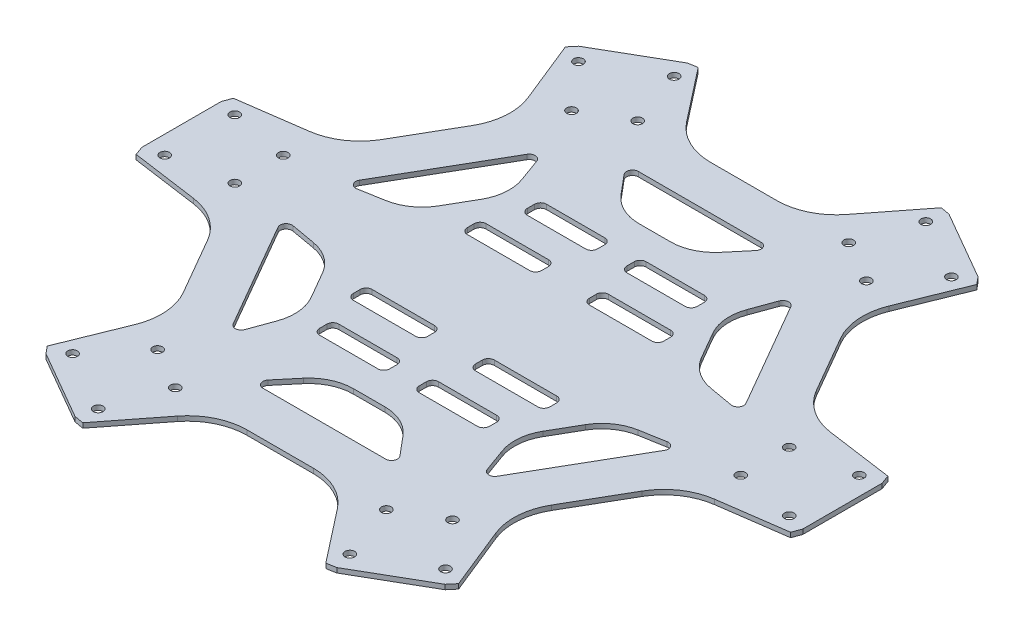
from build123d import *

# Parameters (mm, degrees)
SKETCH1_R            = 1.625
BOSS_EXTRUDE1_DEPTH  = 1.6
CIRPATTERN2_COUNT    = 6
CUT_EXTRUDE1_DEPTH   = 152.890574984
MIRROR6_COPY_1_DEPTH = 152.890574984
MIRROR6_COPY_2_DEPTH = 152.890574984


with BuildPart() as part:
    # Sketch1 → Boss-Extrude1 (new body)
    with BuildSketch(Plane(origin=(0, 0, 0), x_dir=(1, 0, 0), z_dir=(0, 1, 0))):
        with BuildLine():
            Line((0, 0), (-41.603860398, 24.02))
            Line((-41.603860398, 24.02), (-44.228357667, 19.474237386))
            ThreePointArc((-44.228357667, 19.474237386), (-48.615092178, 14.686956722), (-54.614016059, 12.202121091))
            Line((-54.614016059, 12.202121091), (-62.913996832, 10.738610541))
            ThreePointArc((-62.913996832, 10.738610541), (-64.899597276, 11.561073174), (-64.993343995, 13.708226047))
            Line((-64.993343995, 13.708226047), (-54.680843995, 31.57))
            Line((-54.680843995, 31.57), (-67.498019971, 38.97))
            Line((-67.498019971, 38.97), (-73.074504849, 29.311244864))
            ThreePointArc((-73.074504849, 29.311244864), (-79.211154855, 22.730493412), (-87.611550905, 19.505883489))
            Line((-87.611550905, 19.505883489), (-110.066828729, 16.35))
            Line((-110.066828729, 16.35), (-111.161293187, 13.342983613))
            Line((-111.161293187, 13.342983613), (-111.161293187, 0))
            Line((-111.161293187, 0), (-111.161293187, -13.342983613))
            Line((-111.161293187, -13.342983613), (-110.066828729, -16.35))
            Line((-110.066828729, -16.35), (-87.611550905, -19.505883489))
            ThreePointArc((-87.611550905, -19.505883489), (-79.211154855, -22.730493412), (-73.074504849, -29.311244864))
            Line((-73.074504849, -29.311244864), (-67.498019971, -38.97))
            Line((-67.498019971, -38.97), (-54.680843995, -31.57))
            Line((-54.680843995, -31.57), (-64.993343995, -13.708226047))
            ThreePointArc((-64.993343995, -13.708226047), (-64.899597276, -11.561073174), (-62.913996832, -10.738610541))
            Line((-62.913996832, -10.738610541), (-54.614016059, -12.202121091))
            ThreePointArc((-54.614016059, -12.202121091), (-48.615092178, -14.686956722), (-44.228357667, -19.474237386))
            Line((-44.228357667, -19.474237386), (-41.603860398, -24.02))
            Line((-41.603860398, -24.02), (0, 0))
        make_face()
        with Locations((-105.036293187, 11.780646598)):
            Circle(SKETCH1_R, mode=Mode.SUBTRACT)
        with Locations((-85.076293187, 8.143141746)):
            Circle(SKETCH1_R, mode=Mode.SUBTRACT)
        with Locations((-105.036293187, -11.780646598)):
            Circle(SKETCH1_R, mode=Mode.SUBTRACT)
        with Locations((-85.076293187, -8.143141746)):
            Circle(SKETCH1_R, mode=Mode.SUBTRACT)
    boss_extrude1 = extrude(amount=BOSS_EXTRUDE1_DEPTH)

    # CirPattern2: Boss-Extrude1 ×6 about axis
    cirpattern2_axis = Axis((0, 1.6, 0), (0, -1, 0))
    for i in range(1, CIRPATTERN2_COUNT):
        add(boss_extrude1.rotate(cirpattern2_axis, i * 360 / CIRPATTERN2_COUNT))

    # Sketch2 → Cut-Extrude1 (cut, through all)
    with BuildSketch(Plane(origin=(0, 0, 0), x_dir=(1, 0, 0), z_dir=(0, 1, 0))):
        with BuildLine():
            Line((-26.56, 38.16), (-6.96, 38.16))
            ThreePointArc((-6.96, 38.16), (-5.545786438, 37.574213562), (-4.96, 36.16))
            Line((-4.96, 36.16), (-4.96, 33.7))
            ThreePointArc((-4.96, 33.7), (-5.545786438, 32.285786438), (-6.96, 31.7))
            Line((-6.96, 31.7), (-26.56, 31.7))
            ThreePointArc((-26.56, 31.7), (-27.974213562, 32.285786438), (-28.56, 33.7))
            Line((-28.56, 33.7), (-28.56, 36.16))
            ThreePointArc((-28.56, 36.16), (-27.974213562, 37.574213562), (-26.56, 38.16))
        make_face()
        with BuildLine():
            Line((-31.05, 22.33), (-10.05, 22.33))
            ThreePointArc((-10.05, 22.33), (-8.635786438, 21.744213562), (-8.05, 20.33))
            Line((-8.05, 20.33), (-8.05, 18))
            ThreePointArc((-8.05, 18), (-8.635786438, 16.585786438), (-10.05, 16))
            Line((-10.05, 16), (-31.05, 16))
            ThreePointArc((-31.05, 16), (-32.464213562, 16.585786438), (-33.05, 18))
            Line((-33.05, 18), (-33.05, 20.33))
            ThreePointArc((-33.05, 20.33), (-32.464213562, 21.744213562), (-31.05, 22.33))
        make_face()
    cut_extrude1 = extrude(amount=CUT_EXTRUDE1_DEPTH, mode=Mode.SUBTRACT)

    # Mirror5: Cut-Extrude1 across plane
    add(cut_extrude1.mirror(Plane.XY), mode=Mode.SUBTRACT)

    # Mirror6 copy 1 sketch → Mirror6 copy 1 (cut, through all)
    with BuildSketch(Plane(origin=(0, 0, 0), x_dir=(-1, 0, 0), z_dir=(0, 1, 0))):
        with BuildLine():
            Line((-26.56, 38.16), (-6.96, 38.16))
            ThreePointArc((-6.96, 38.16), (-5.545786438, 37.574213562), (-4.96, 36.16))
            Line((-4.96, 36.16), (-4.96, 33.7))
            ThreePointArc((-4.96, 33.7), (-5.545786438, 32.285786438), (-6.96, 31.7))
            Line((-6.96, 31.7), (-26.56, 31.7))
            ThreePointArc((-26.56, 31.7), (-27.974213562, 32.285786438), (-28.56, 33.7))
            Line((-28.56, 33.7), (-28.56, 36.16))
            ThreePointArc((-28.56, 36.16), (-27.974213562, 37.574213562), (-26.56, 38.16))
        make_face()
        with BuildLine():
            Line((-31.05, 22.33), (-10.05, 22.33))
            ThreePointArc((-10.05, 22.33), (-8.635786438, 21.744213562), (-8.05, 20.33))
            Line((-8.05, 20.33), (-8.05, 18))
            ThreePointArc((-8.05, 18), (-8.635786438, 16.585786438), (-10.05, 16))
            Line((-10.05, 16), (-31.05, 16))
            ThreePointArc((-31.05, 16), (-32.464213562, 16.585786438), (-33.05, 18))
            Line((-33.05, 18), (-33.05, 20.33))
            ThreePointArc((-33.05, 20.33), (-32.464213562, 21.744213562), (-31.05, 22.33))
        make_face()
    extrude(amount=MIRROR6_COPY_1_DEPTH, mode=Mode.SUBTRACT)

    # Mirror6 copy 2 sketch → Mirror6 copy 2 (cut, through all)
    with BuildSketch(Plane(origin=(0, 0, 0), x_dir=(-1, 0, 0), z_dir=(0, 1, 0))):
        with BuildLine():
            Line((-26.56, -38.16), (-6.96, -38.16))
            ThreePointArc((-6.96, -38.16), (-5.545786438, -37.574213562), (-4.96, -36.16))
            Line((-4.96, -36.16), (-4.96, -33.7))
            ThreePointArc((-4.96, -33.7), (-5.545786438, -32.285786438), (-6.96, -31.7))
            Line((-6.96, -31.7), (-26.56, -31.7))
            ThreePointArc((-26.56, -31.7), (-27.974213562, -32.285786438), (-28.56, -33.7))
            Line((-28.56, -33.7), (-28.56, -36.16))
            ThreePointArc((-28.56, -36.16), (-27.974213562, -37.574213562), (-26.56, -38.16))
        make_face()
        with BuildLine():
            Line((-31.05, -22.33), (-10.05, -22.33))
            ThreePointArc((-10.05, -22.33), (-8.635786438, -21.744213562), (-8.05, -20.33))
            Line((-8.05, -20.33), (-8.05, -18))
            ThreePointArc((-8.05, -18), (-8.635786438, -16.585786438), (-10.05, -16))
            Line((-10.05, -16), (-31.05, -16))
            ThreePointArc((-31.05, -16), (-32.464213562, -16.585786438), (-33.05, -18))
            Line((-33.05, -18), (-33.05, -20.33))
            ThreePointArc((-33.05, -20.33), (-32.464213562, -21.744213562), (-31.05, -22.33))
        make_face()
    extrude(amount=MIRROR6_COPY_2_DEPTH, mode=Mode.SUBTRACT)


solid = part.part
